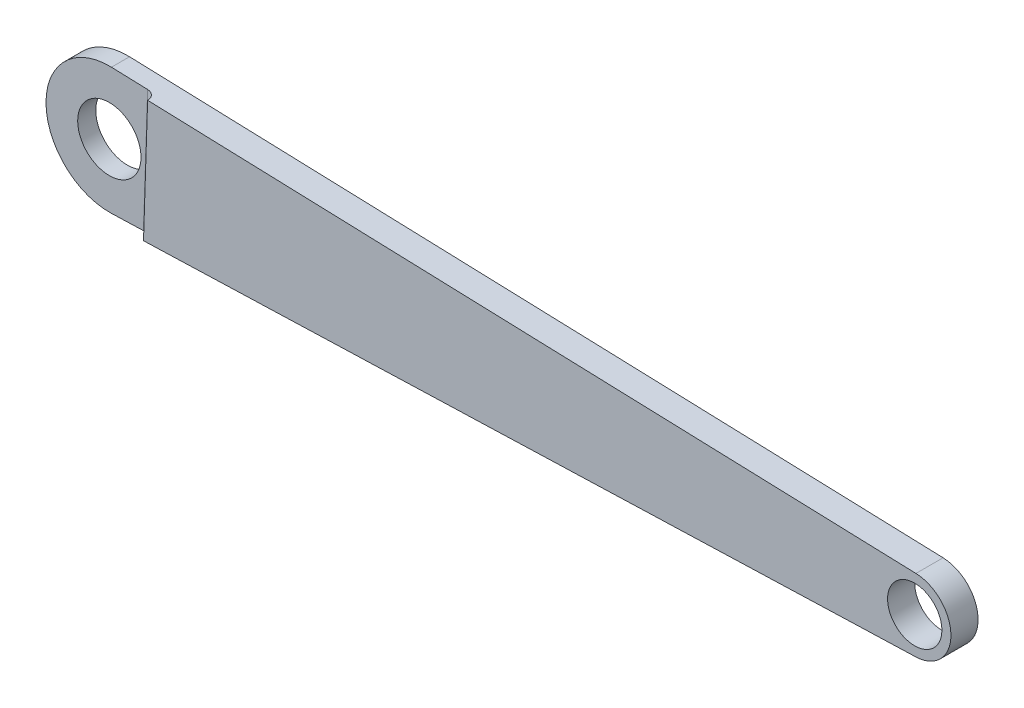
from build123d import *

# Parameters (mm, degrees)
SKETCH1_R               = 88.9
SKETCH1_R_2             = 76.2
BOSS_EXTRUDE1_DEPTH     = 38.1
CUT_EXTRUDE1_DEPTH      = 1364.467617688
CUT_EXTRUDE1_DEPTH_BACK = 1364.467617688
SKETCH2_W               = 304.8
SKETCH2_H               = 25.4
FILLET1_R               = 25.4


with BuildPart() as part:
    # Sketch1 → Boss-Extrude1 (new, symmetric)
    with BuildSketch(Plane.XY):
        with BuildLine():
            Line((-1137.073333333, 177.701194769), (1146.386666667, 101.543539868))
            ThreePointArc((1146.386666667, 101.543539868), (1244.6, 0), (1146.386666667, -101.543539868))
            Line((1146.386666667, -101.543539868), (-1137.073333333, -177.701194769))
            ThreePointArc((-1137.073333333, -177.701194769), (-1320.8, 0), (-1137.073333333, 177.701194769))
        make_face()
        with Locations(Location((-1143, 0, 0), (0, 0, 180))):
            Circle(SKETCH1_R, mode=Mode.SUBTRACT)
        with Locations(Location((1143, 0, 0), (0, 0, 180))):
            Circle(SKETCH1_R_2, mode=Mode.SUBTRACT)
    extrude(amount=BOSS_EXTRUDE1_DEPTH, both=True)

    # Sketch2 → Cut-Extrude1 (cut, two sides: drawn at the far end of the back side and taken through both)
    with BuildSketch(Plane(origin=(4.656666667, 139.622367318, 0), x_dir=(0.9994442900376634, -0.03333333333333318, 0), z_dir=(0.03333333333333318, 0.9994442900376634, 0)).offset(-CUT_EXTRUDE1_DEPTH_BACK)):
        with Locations((-1167.764823513, -25.4)):
            Rectangle(SKETCH2_W, SKETCH2_H)
    extrude(amount=CUT_EXTRUDE1_DEPTH + CUT_EXTRUDE1_DEPTH_BACK, mode=Mode.SUBTRACT)

    # Fillet1
    fillet1_edges = [part.edges().sort_by_distance(p)[0] for p in [
        (-1015.935828218, -0.193171338, 12.7),
    ]]
    fillet(fillet1_edges, radius=FILLET1_R - 0.0001)  # a hair under: the kernel refuses the full size


solid = part.part
